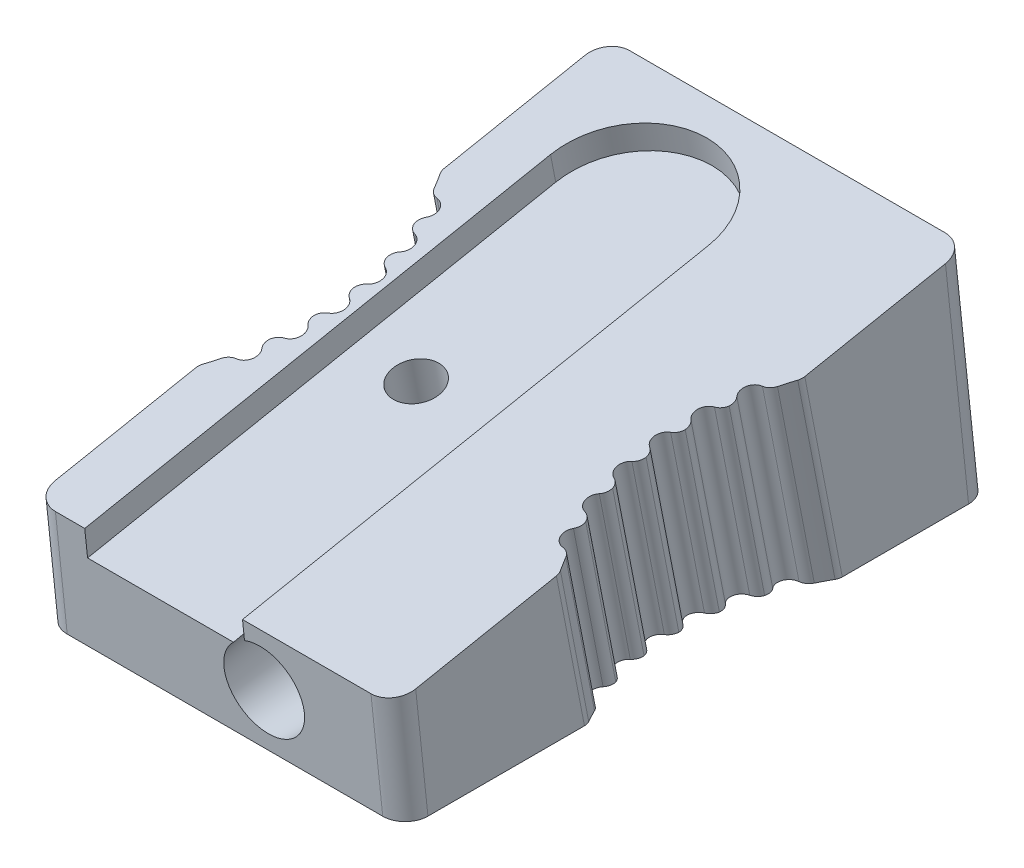
from build123d import *

# Parameters (mm, degrees)
BOSS_EXTRUDE1_DEPTH          = 16
CUT_EXTRUDE1_REACH           = 32.943
CUT_EXTRUDE4_DEPTH           = 1.2
SKETCH6_W                    = 7.000000000000001
SKETCH6_H                    = 1.1999999999999869
CUT_EXTRUDE5_DEPTH           = 1.2
M2_5X0_45_TAPPED_HOLE2_D     = 2.05
M2_5X0_45_TAPPED_HOLE2_DEPTH = 4
M2_5X0_45_TAPPED_HOLE2_TIP   = 0.6158821345032492
SKETCH11_R                   = 0.5000000000000004
SKETCH11_R_2                 = 0.5000000000000009
SKETCH11_R_3                 = 0.49999999999999917
CUT_EXTRUDE6_DEPTH           = 31.9427848040178
FILLET1_R                    = 1
FILLET3_R                    = 0.5


with BuildPart() as part:
    # Sketch1 → Boss-Extrude1 (new body)
    with BuildSketch(Plane(origin=(0, 0, 0), x_dir=(0, 0, -1), z_dir=(1, 0, 0))):
        Polygon((0, 0), (-26, 0), (-26.522642316338285, 4.972609476841361), (-1.0452846326765777, 9.945218953682728), align=None)
    extrude(amount=BOSS_EXTRUDE1_DEPTH)

    # Cut-Extrude1: up to this plane
    cut_extrude1_end = Plane(origin=(16, 0, 0), z_dir=(0, 1, 0))
    # Sketch2 → Cut-Extrude1 (cut, up to the surface)
    with BuildSketch(Plane(origin=(0, 9.776794987365424, 1.9082113620630834), x_dir=(1, 0, 0), z_dir=(0, 0.9814803246385702, 0.19156297227639538)), mode=Mode.PRIVATE) as cut_extrude1_sk1:
        with BuildLine():
            Line((0, -6.62079059791211), (0, -17.578883739558876))
            ThreePointArc((0, -17.578883739558876), (1.5000000000000018, -12.099837168735492), (0, -6.62079059791211))
        make_face()
    cut_extrude1_tool1 = split(extrude(cut_extrude1_sk1.sketch, amount=-CUT_EXTRUDE1_REACH, mode=Mode.PRIVATE), bisect_by=cut_extrude1_end, keep=Keep.BOTH, mode=Mode.PRIVATE)
    add(cut_extrude1_tool1.solids().sort_by_distance((0.603737, 7.458914, 13.783963))[0], mode=Mode.SUBTRACT)
    # Sketch2 → Cut-Extrude1 (cut, up to the surface)
    with BuildSketch(Plane(origin=(0, 9.776794987365424, 1.9082113620630834), x_dir=(1, 0, 0), z_dir=(0, 0.9814803246385702, 0.19156297227639538)), mode=Mode.PRIVATE) as cut_extrude1_sk2:
        with BuildLine():
            Line((16, -6.62079059791211), (16, -17.578883739558876))
            ThreePointArc((16, -17.578883739558876), (14.499999999999998, -12.09983716873549), (16, -6.62079059791211))
        make_face()
    cut_extrude1_tool2 = split(extrude(cut_extrude1_sk2.sketch, amount=-CUT_EXTRUDE1_REACH, mode=Mode.PRIVATE), bisect_by=cut_extrude1_end, keep=Keep.BOTH, mode=Mode.PRIVATE)
    add(cut_extrude1_tool2.solids().sort_by_distance((15.396263, 7.458914, 13.783963))[0], mode=Mode.SUBTRACT)

    # Sketch3 → Cut-Revolve2 (revolve, cut)
    with BuildSketch(Plane(origin=(10, 0, 0), x_dir=(0, 0, -1), z_dir=(1, 0, 0)), mode=Mode.PRIVATE) as cut_revolve2_sk:
        Polygon((-27.256723261264806, 2.390150892266835), (-26.261321158169142, 2.486304738420681), (-0.5226423163382883, 4.972609476841364), (0.4727597867573756, 5.068763322995212), (0.05464593368674497, 9.046850904468306), (-27.43442164881982, 4.080838114392899), align=None)
    revolve(cut_revolve2_sk.sketch.rotate(Axis((10, 2.390150892266835, 27.256723261264806), (0, 0.09615043724968246, -0.9953668134997745)), 180), axis=Axis((10, 2.390150892266835, 27.256723261264806), (0, 0.09615043724968246, -0.9953668134997745)), mode=Mode.SUBTRACT)

    # Sketch4 → Cut-Extrude4 (cut)
    with BuildSketch(Plane(origin=(0, 9.776794987365424, 1.9082113620630834), x_dir=(1, 0, 0), z_dir=(0, 0.9814803246385702, 0.19156297227639538))):
        with BuildLine():
            Line((2.3, -25.078883739558876), (2.3, -4.02079059791211))
            ThreePointArc((2.3, -4.02079059791211), (5.8, -0.5207905979121099), (9.299999999999999, -4.02079059791211))
            Line((9.299999999999999, -4.02079059791211), (9.299999999999999, -25.078883739558876))
            Line((9.299999999999999, -25.078883739558876), (2.3, -25.078883739558876))
        make_face()
    extrude(amount=-CUT_EXTRUDE4_DEPTH, mode=Mode.SUBTRACT)

    # Sketch6 → Cut-Extrude5 (cut)
    with BuildSketch(Plane(origin=(0, -4.8041855105240625, 24.61443095427521), x_dir=(-1, 0, 0), z_dir=(0, 0.1915629722763954, -0.9814803246385702))):
        with Locations((-5.799999999999999, 9.36127455837256)):
            Rectangle(SKETCH6_W, SKETCH6_H)
    extrude(amount=-CUT_EXTRUDE5_DEPTH, mode=Mode.SUBTRACT)

    # M2.5x0.45 Tapped Hole2
    with Locations(Plane(origin=(5.1, 6.073299307, 14.618956627), x_dir=(0, -0.191562972276, 0.981480324639), z_dir=(0, 0.981480324639, 0.191562972276))):
        with Locations((0, 0)):
            Hole(M2_5X0_45_TAPPED_HOLE2_D / 2, depth=M2_5X0_45_TAPPED_HOLE2_DEPTH)
            with Locations((0, 0, -(M2_5X0_45_TAPPED_HOLE2_DEPTH + M2_5X0_45_TAPPED_HOLE2_TIP / 2))):  # 118° drill point
                Cone(0, M2_5X0_45_TAPPED_HOLE2_D / 2, M2_5X0_45_TAPPED_HOLE2_TIP, mode=Mode.SUBTRACT)

    # Sketch11 → Cut-Extrude6 (cut, through all)
    with BuildSketch(Plane(origin=(0, 9.776794987365424, 1.9082113620630834), x_dir=(1, 0, 0), z_dir=(0, 0.9814803246385702, 0.19156297227639538))):
        with Locations((0.7290719760898604, -8.100977766374406)):
            Circle(SKETCH11_R)
        with Locations((1.223184312982648, -9.67525633083825)):
            Circle(SKETCH11_R_2)
        with Locations((1.47071076557147, -11.306584211820118)):
            Circle(SKETCH11_R)
        with Locations((1.4658271457246748, -12.956576984609502)):
            Circle(SKETCH11_R)
        with Locations((1.208648362860844, -14.586411047833327)):
            Circle(SKETCH11_R)
        with Locations((0.7052257201809217, -16.15773712565332)):
            Circle(SKETCH11_R)
        with Locations((15.294774279819078, -16.15773712565332)):
            Circle(SKETCH11_R_3)
        with Locations((14.791351637139156, -14.586411047833327)):
            Circle(SKETCH11_R_2)
        with Locations((14.534172854275326, -12.956576984609502)):
            Circle(SKETCH11_R_2)
        with Locations((14.52928923442853, -11.306584211820118)):
            Circle(SKETCH11_R_3)
        with Locations((14.77681568701735, -9.67525633083825)):
            Circle(SKETCH11_R_3)
        with Locations((15.270928023910141, -8.100977766374406)):
            Circle(SKETCH11_R_2)
    extrude(amount=-CUT_EXTRUDE6_DEPTH, mode=Mode.SUBTRACT)

    # Fillet1
    fillet1_edges = [part.edges().sort_by_distance(p)[0] for p in [
        (16, 2.4863047384206807, 26.261321158169142),
        (16, 4.972609476841364, 0.5226423163382888),
        (0, 2.4863047384206807, 26.261321158169142),
        (0, 4.972609476841364, 0.5226423163382888),
    ]]
    fillet(fillet1_edges, radius=FILLET1_R)

    # Fillet3
    # the kernel refuses this fillet: 0.5 mm, written as the material it takes off along each edge
    with BuildSketch(Plane(origin=(-8.9e-16, 8.84027782449705, 8.471143317909705), x_dir=(6.568558896759944e-15, 0.19156297227639535, -0.9814803246385702), z_dir=(0, -0.9814803246385702, -0.19156297227639538))) as fillet3_piece_1:
        with BuildLine():
            CenterArc((0.13521663330723216, 0.5000000000000001), FILLET3_R, 240.08261327743668, 29.917386722562924)
            ThreePointArc((-0.11415875740879698, 0.06662727992497329), (-0.056977036870341, 0.0334889918096563), (0, 0))
            Line((0, 0), (0.13521663330722888, 0))
        make_face()
    extrude(amount=9.345127718950396, mode=Mode.SUBTRACT)
    with BuildSketch(Plane(origin=(0, 6.741112931801604, 19.22629613199286), x_dir=(0.5040667225652466, 0.16544617977427759, -0.8476699244401845), z_dir=(0, -0.9814803246385702, -0.19156297227639538))) as fillet3_piece_2:
        with BuildLine():
            CenterArc((0.13525152627151035, 0.4999905624749505), FILLET3_R, 239.73058109352934, 29.917386722571507)
            Line((-0.11678183501117555, 0.06815820518736707), (0, 0))
            ThreePointArc((0, 0), (0.06608974262947756, 0.00020303231598987), (0.13217948525895262, 0))
        make_face()
    extrude(amount=7.206353420577709, mode=Mode.SUBTRACT)
    with BuildSketch(Plane(origin=(0.9041123722790791, -0.8507763634373475, 8.564980938480485), x_dir=(0.8189747474071976, 0.1099244959567053, -0.5632024221343348), z_dir=(0, 0.9814803246385702, 0.19156297227639538))) as fillet3_piece_3:
        with BuildLine():
            CenterArc((0.3762150218917622, -0.48401816509794676), FILLET3_R, 104.52544984263686, 57.77038124776779)
            ThreePointArc((-0.10010465656917535, -0.3319669766419895), (-0.04871465560991424, -0.1663868635755278), (0, 0))
            ThreePointArc((0, 0), (0.1254050072972659, -0.01598183490205357), (0.250810014594537, -1e-17))
        make_face()
    extrude(amount=10.022391383047378, mode=Mode.SUBTRACT)
    with BuildSketch(Plane(origin=(0.5324558554564609, -0.8507763634373315, 7.6193895486969305), x_dir=(-0.4291086570829379, 0.17302980589976627, -0.8865249272788481), z_dir=(0, 0.9814803246385702, 0.19156297227639538))) as fillet3_piece_4:
        with BuildLine():
            CenterArc((0.35479045509600643, -0.49993505559679685), FILLET3_R, 90.92348148822464, 57.77038124776763)
            ThreePointArc((-0.07241113325413223, -0.24012973827030512), (-0.02090428833356213, -0.1246789702850145), (0, 0))
            ThreePointArc((0, 0), (0.1733659538719006, -0.00139716848681071), (0.3467319077437987, 3e-17))
        make_face()
    extrude(amount=10.203531680233258, mode=Mode.SUBTRACT)
    with BuildSketch(Plane(origin=(1.3245336837372133, -0.8507763634374137, 10.190626753655996), x_dir=(0.8971021301305255, 0.08463697149506566, -0.43364080893225093), z_dir=(0, 0.9814803246385702, 0.19156297227639538))) as fillet3_piece_5:
        with BuildLine():
            CenterArc((0.37621502189180767, -0.48401816509793244), FILLET3_R, 104.52544984264316, 57.770381247768)
            ThreePointArc((-0.10010465656914697, -0.331966976642029), (-0.0487146556099016, -0.16638686357554658), (0, 0))
            ThreePointArc((0, 0), (0.12540500729726603, -0.01598183490206699), (0.2508100145945294, 1e-17))
        make_face()
    extrude(amount=9.71097783882381, mode=Mode.SUBTRACT)
    with BuildSketch(Plane(origin=(1.0991916103360686, -0.8507763634374115, 9.198245722442355), x_dir=(-0.28591530273302007, 0.18356615547195718, -0.9405083233168811), z_dir=(0, 0.9814803246385702, 0.19156297227639538))) as fillet3_piece_6:
        with BuildLine():
            CenterArc((0.3547904550960354, -0.49993505559679685), FILLET3_R, 90.92348148822451, 57.770381247767844)
            ThreePointArc((-0.07241113325410303, -0.24012973827030598), (-0.02090428833353382, -0.12467897028501924), (0, 0))
            ThreePointArc((0, 0), (0.17336595387191708, -0.00139716848681245), (0.34673190774382884, 1e-17))
        make_face()
    extrude(amount=9.901081298793802, mode=Mode.SUBTRACT)
    with BuildSketch(Plane(origin=(1.4959844049493585, -0.8507763634373418, 11.862660417370378), x_dir=(0.9541210958561219, 0.05735797646647942, -0.2938758189745864), z_dir=(0, 0.9814803246385702, 0.19156297227639538))) as fillet3_piece_7:
        with BuildLine():
            CenterArc((0.3762150218917593, -0.4840181650979468), FILLET3_R, 104.52544984263653, 57.7703812477678)
            ThreePointArc((-0.10010465656917733, -0.33196697664198677), (-0.04871465560991481, -0.1663868635755268), (0, 0))
            ThreePointArc((0, 0), (0.12540500729726625, -0.01598183490205324), (0.25081001459453706, 2e-17))
        make_face()
    extrude(amount=9.390678100456343, mode=Mode.SUBTRACT)
    with BuildSketch(Plane(origin=(1.4222589744547673, -0.8507763634373324, 10.846840032195322), x_dir=(-0.13599448755852672, 0.18978327446134854, -0.972361973798041), z_dir=(0, 0.9814803246385702, 0.19156297227639538))) as fillet3_piece_8:
        with BuildLine():
            CenterArc((0.35479045509600565, -0.49993505559679685), FILLET3_R, 90.92348148822452, 57.7703812477678)
            ThreePointArc((-0.07241113325413356, -0.2401297382703053), (-0.02090428833355943, -0.12467897028501575), (0, 0))
            ThreePointArc((0, 0), (0.1733659538718988, -0.00139716848681048), (0.346731907743799, 0))
        make_face()
    extrude(amount=9.58527167273942, mode=Mode.SUBTRACT)
    with BuildSketch(Plane(origin=(1.414430376151146, -0.850776363437344, 13.541739715819348), x_dir=(0.9886900134979009, 0.028729373578601385, -0.14719606076013553), z_dir=(0, 0.9814803246385702, 0.19156297227639538))) as fillet3_piece_9:
        with BuildLine():
            CenterArc((0.376215021891753, -0.4840181650979482), FILLET3_R, 104.52544984263595, 57.7703812477681)
            ThreePointArc((-0.10010465656918284, -0.33196697664198593), (-0.04871465560991895, -0.16638686357552782), (0, 0))
            ThreePointArc((0, 0), (0.125405007297266, -0.01598183490205113), (0.2508100145945357, 0))
        make_face()
    extrude(amount=9.069028679357697, mode=Mode.SUBTRACT)
    with BuildSketch(Plane(origin=(1.4940563153884647, -0.8507763634373338, 12.526381781800541), x_dir=(0.017126217858494646, 0.19153487680335024, -0.9813363763918002), z_dir=(0, 0.9814803246385702, 0.19156297227639538))) as fillet3_piece_10:
        with BuildLine():
            CenterArc((0.3547904550960016, -0.499935055596797), FILLET3_R, 90.92348148822401, 57.770381247767745)
            ThreePointArc((-0.07241113325413433, -0.24012973827030146), (-0.0209042883335607, -0.12467897028501354), (0, 0))
            ThreePointArc((0, 0), (0.17336595387189982, -0.00139716848680998), (0.34673190774379936, 0))
        make_face()
    extrude(amount=9.263533663122749, mode=Mode.SUBTRACT)
    with BuildSketch(Plane(origin=(1.081790527629206, -0.8507763634373258, 15.188356654524544), x_dir=(0.9999954916879522, -0.0005752187838453385, 0.0029471557681415915), z_dir=(0, 0.9814803246385702, 0.19156297227639538))) as fillet3_piece_11:
        with BuildLine():
            CenterArc((0.3762150218917628, -0.4840181650979456), FILLET3_R, 104.52544984263676, 57.77038124776712)
            ThreePointArc((-0.10010465656917295, -0.33196697664198166), (-0.04871465560991308, -0.16638686357552615), (0, 0))
            ThreePointArc((0, 0), (0.12540500729726758, -0.01598183490205386), (0.25081001459453883, 0))
        make_face()
    extrude(amount=8.753597844378637, mode=Mode.SUBTRACT)
    with BuildSketch(Plane(origin=(1.3128942734078017, -0.8507763634373329, 14.197352095508087), x_dir=(0.16984395093157206, 0.18877974806829237, -0.967220367367864), z_dir=(0, 0.9814803246385702, 0.19156297227639538))) as fillet3_piece_12:
        with BuildLine():
            CenterArc((0.3547904550960046, -0.49993505559679674), FILLET3_R, 90.9234814882244, 57.77038124776759)
            ThreePointArc((-0.07241113325413241, -0.24012973827030312), (-0.02090428833355955, -0.12467897028501342), (0, 0))
            ThreePointArc((0, 0), (0.17336595387190104, -0.00139716848681042), (0.34673190774379903, 1e-17))
        make_face()
    extrude(amount=8.943437623243309, mode=Mode.SUBTRACT)
    with BuildSketch(Plane(origin=(0.5058917281388445, -0.8507763634373608, 16.76376706399826), x_dir=(0.9877715175165039, -0.029866276502300365, 0.15302102702253312), z_dir=(0, 0.9814803246385702, 0.19156297227639538))) as fillet3_piece_13:
        with BuildLine():
            CenterArc((0.3762150218917617, -0.4840181650979452), FILLET3_R, 104.52544984263687, 57.770381247768626)
            ThreePointArc((-0.10010465656917751, -0.3319669766419951), (-0.0487146556099147, -0.16638686357553534), (0, 0))
            ThreePointArc((0, 0), (0.12540500729726767, -0.01598183490205408), (0.2508100145945368, 0))
        make_face()
    extrude(amount=8.45180754378475, mode=Mode.SUBTRACT)
    with BuildSketch(Plane(origin=(0.8830355113666977, -0.8507763634373338, 15.820433779669933), x_dir=(0.3185653308355022, 0.1815827152187566, -0.9303460901855024), z_dir=(0, 0.9814803246385702, 0.19156297227639538))) as fillet3_piece_14:
        with BuildLine():
            CenterArc((0.35479045509600166, -0.4999350555967969), FILLET3_R, 90.92348148822403, 57.77038124776756)
            ThreePointArc((-0.07241113325413301, -0.2401297382703006), (-0.02090428833355908, -0.12467897028501372), (0, 0))
            ThreePointArc((0, 0), (0.17336595387190032, -0.00139716848680764), (0.3467319077437993, 0))
        make_face()
    extrude(amount=8.632515271577889, mode=Mode.SUBTRACT)
    with BuildSketch(Plane(origin=(16, 6.741112931801586, 19.226296131992857), x_dir=(-0.5040667225652338, 0.165446179774279, -0.8476699244401917), z_dir=(0, -0.9814803246385702, -0.19156297227639538))) as fillet3_piece_15:
        with BuildLine():
            CenterArc((0.1352515262715016, -0.49999056247495016), FILLET3_R, 90.35203218389827, 29.917386722570683)
            Line((-0.11678183501117242, -0.06815820518735785), (0, 0))
            ThreePointArc((0, 0), (0.06608974262948056, -0.00020303231598909), (0.13217948525895146, 2e-17))
        make_face()
    extrude(amount=7.206353420577674, mode=Mode.SUBTRACT)
    with BuildSketch(Plane(origin=(16, 8.840277824497045, 8.471143317909705), x_dir=(0, 0.19156297227639535, -0.98148032463857), z_dir=(0, -0.9814803246385702, -0.19156297227639538))) as fillet3_piece_16:
        with BuildLine():
            CenterArc((0.13521663330722677, -0.5), FILLET3_R, 90, 29.917386722563208)
            ThreePointArc((-0.11415875740880158, -0.06662727992497253), (-0.05697703687034154, -0.03348899180965503), (0, 0))
            Line((0, 0), (0.13521663330722677, 0))
        make_face()
    extrude(amount=9.345127718950387, mode=Mode.SUBTRACT)
    with BuildSketch(Plane(origin=(15.1169644886333, -0.8507763634373315, 15.820433779669933), x_dir=(-0.3185653308354956, 0.18158271521875696, -0.9303460901855045), z_dir=(0, 0.9814803246385702, 0.19156297227639538))) as fillet3_piece_17:
        with BuildLine():
            CenterArc((0.3547904550959971, 0.49993505559679646), FILLET3_R, 211.3061372640089, 57.77038124776749)
            ThreePointArc((-0.07241113325413587, 0.24012973827029624), (-0.02090428833356441, 0.12467897028501176), (0, 0))
            ThreePointArc((0, 0), (0.17336595387190015, 0.00139716848680865), (0.3467319077437984, 0))
        make_face()
    extrude(amount=8.632515271577885, mode=Mode.SUBTRACT)
    with BuildSketch(Plane(origin=(15.494108271861156, -0.8507763634373524, 16.76376706399826), x_dir=(-0.9877715175165045, -0.029866276502300025, 0.1530210270225314), z_dir=(0, 0.9814803246385702, 0.19156297227639538))) as fillet3_piece_18:
        with BuildLine():
            CenterArc((0.37621502189176137, 0.4840181650979457), FILLET3_R, 197.704168909595, 57.77038124776823)
            ThreePointArc((-0.10010465656917691, 0.33196697664199126), (-0.0487146556099134, 0.16638686357552773), (0, 0))
            ThreePointArc((0, 0), (0.12540500729726797, 0.01598183490205409), (0.25081001459453756, 0))
        make_face()
    extrude(amount=8.45180754378473, mode=Mode.SUBTRACT)
    with BuildSketch(Plane(origin=(14.687105726592199, -0.8507763634373378, 14.197352095508087), x_dir=(-0.16984395093157742, 0.18877974806829217, -0.9672203673678631), z_dir=(0, 0.9814803246385702, 0.19156297227639538))) as fillet3_piece_19:
        with BuildLine():
            CenterArc((0.35479045509600937, 0.4999350555967965), FILLET3_R, 211.30613726400765, 57.77038124776766)
            ThreePointArc((-0.07241113325412894, 0.2401297382703059), (-0.02090428833355873, 0.12467897028501487), (0, 0))
            ThreePointArc((0, 0), (0.17336595387190126, 0.00139716848681171), (0.34673190774380114, 1e-17))
        make_face()
    extrude(amount=8.943437623243318, mode=Mode.SUBTRACT)
    with BuildSketch(Plane(origin=(14.918209472370792, -0.8507763634373466, 15.18835665452454), x_dir=(-0.999995491687952, -0.0005752187838454116, 0.0029471557681419657), z_dir=(0, 0.9814803246385702, 0.19156297227639538))) as fillet3_piece_20:
        with BuildLine():
            CenterArc((0.3762150218917571, 0.48401816509794876), FILLET3_R, 197.7041689095957, 57.77038124776789)
            ThreePointArc((-0.100104656569179, 0.3319669766419887), (-0.04871465560991478, 0.16638686357552956), (0, 0))
            ThreePointArc((0, 0), (0.125405007297266, 0.01598183490205373), (0.2508100145945352, 0))
        make_face()
    extrude(amount=8.753597844378675, mode=Mode.SUBTRACT)
    with BuildSketch(Plane(origin=(14.505943684611536, -0.8507763634373342, 12.526381781800541), x_dir=(-0.017126217858495926, 0.19153487680335024, -0.9813363763918002), z_dir=(0, 0.9814803246385702, 0.19156297227639538))) as fillet3_piece_21:
        with BuildLine():
            CenterArc((0.35479045509600227, 0.49993505559679735), FILLET3_R, 211.30613726400827, 57.77038124776766)
            ThreePointArc((-0.07241113325413402, 0.24012973827030154), (-0.02090428833356055, 0.12467897028501357), (0, 0))
            ThreePointArc((0, 0), (0.17336595387190337, 0.00139716848680837), (0.3467319077437994, 0))
        make_face()
    extrude(amount=9.263533663122749, mode=Mode.SUBTRACT)
    with BuildSketch(Plane(origin=(14.585569623848851, -0.8507763634373453, 13.541739715819348), x_dir=(-0.9886900134979008, 0.02872937357860178, -0.14719606076013753), z_dir=(0, 0.9814803246385702, 0.19156297227639538))) as fillet3_piece_22:
        with BuildLine():
            CenterArc((0.3762150218917472, 0.4840181650979484), FILLET3_R, 197.7041689095961, 57.77038124776817)
            ThreePointArc((-0.1001046565691877, 0.33196697664198516), (-0.04871465560992195, 0.16638686357552743), (0, 0))
            ThreePointArc((0, 0), (0.12540500729726534, 0.01598183490205137), (0.2508100145945318, 0))
        make_face()
    extrude(amount=9.0690286793577, mode=Mode.SUBTRACT)
    with BuildSketch(Plane(origin=(14.577741025545231, -0.8507763634373329, 10.846840032195322), x_dir=(0.13599448755853047, 0.18978327446134843, -0.9723619737980406), z_dir=(0, 0.9814803246385702, 0.19156297227639538))) as fillet3_piece_23:
        with BuildLine():
            CenterArc((0.35479045509600415, 0.4999350555967963), FILLET3_R, 211.30613726400802, 57.77038124776766)
            ThreePointArc((-0.07241113325413258, 0.24012973827030282), (-0.02090428833356162, 0.12467897028501343), (0, 0))
            ThreePointArc((0, 0), (0.173365953871899, 0.00139716848680981), (0.34673190774379925, 0))
        make_face()
    extrude(amount=9.58527167273942, mode=Mode.SUBTRACT)
    with BuildSketch(Plane(origin=(14.504015595050639, -0.8507763634373409, 11.86266041737038), x_dir=(-0.9541210958561195, 0.05735797646648098, -0.2938758189745944), z_dir=(0, 0.9814803246385702, 0.19156297227639538))) as fillet3_piece_24:
        with BuildLine():
            CenterArc((0.3762150218917545, 0.48401816509794815), FILLET3_R, 197.70416890959598, 57.77038124776794)
            ThreePointArc((-0.10010465656918101, 0.3319669766419857), (-0.04871465560991879, 0.16638686357552568), (0, 0))
            ThreePointArc((0, 0), (0.12540500729726495, 0.01598183490205212), (0.2508100145945359, 0))
        make_face()
    extrude(amount=9.390678100456341, mode=Mode.SUBTRACT)
    with BuildSketch(Plane(origin=(14.90080838966393, -0.8507763634374079, 9.198245722442357), x_dir=(0.2859153027330282, 0.18356615547195673, -0.9405083233168786), z_dir=(0, 0.9814803246385702, 0.19156297227639538))) as fillet3_piece_25:
        with BuildLine():
            CenterArc((0.35479045509602963, 0.4999350555967975), FILLET3_R, 211.3061372640082, 57.77038124776777)
            ThreePointArc((-0.0724111332541061, 0.24012973827030268), (-0.0209042883335366, 0.12467897028501876), (0, 0))
            ThreePointArc((0, 0), (0.17336595387191572, 0.00139716848681119), (0.3467319077438275, 0))
        make_face()
    extrude(amount=9.901081298793795, mode=Mode.SUBTRACT)
    with BuildSketch(Plane(origin=(14.675466316262785, -0.8507763634374088, 10.190626753656), x_dir=(-0.8971021301305181, 0.08463697149506859, -0.433640808932266), z_dir=(0, 0.9814803246385702, 0.19156297227639538))) as fillet3_piece_26:
        with BuildLine():
            CenterArc((0.376215021891799, 0.4840181650979346), FILLET3_R, 197.7041689095896, 57.77038124776823)
            ThreePointArc((-0.10010465656915297, 0.33196697664202507), (-0.0487146556099036, 0.16638686357554403), (0, 0))
            ThreePointArc((0, 0), (0.1254050072972662, 0.01598183490206527), (0.25081001459452906, 0))
        make_face()
    extrude(amount=9.7109778388238, mode=Mode.SUBTRACT)
    with BuildSketch(Plane(origin=(15.467544144543528, -0.8507763634374061, 7.619389548696939), x_dir=(0.42910865708294166, 0.17302980589976596, -0.8865249272788464), z_dir=(0, 0.9814803246385702, 0.19156297227639538))) as fillet3_piece_27:
        with BuildLine():
            CenterArc((0.35479045509603263, 0.49993505559679774), FILLET3_R, 211.30613726400813, 57.770381247767546)
            ThreePointArc((-0.07241113325410442, 0.24012973827030298), (-0.0209042883335355, 0.12467897028501611), (0, 0))
            ThreePointArc((0, 0), (0.17336595387191303, 0.00139716848681047), (0.3467319077438274, 1e-17))
        make_face()
    extrude(amount=10.2035316802334, mode=Mode.SUBTRACT)
    with BuildSketch(Plane(origin=(15.095887627720929, -0.850776363437399, 8.56498093848045), x_dir=(-0.8189747474072521, 0.10992449595669035, -0.5632024221342583), z_dir=(0, 0.9814803246385702, 0.19156297227639538))) as fillet3_piece_28:
        with BuildLine():
            CenterArc((0.3762150218918041, 0.48401816509793455), FILLET3_R, 197.70416890958984, 57.77038124776749)
            ThreePointArc((-0.10010465656914745, 0.3319669766420232), (-0.04871465560990263, 0.16638686357554305), (0, 0))
            ThreePointArc((0, 0), (0.12540500729726536, 0.01598183490206698), (0.25081001459452973, 0))
        make_face()
    extrude(amount=10.022391383047495, mode=Mode.SUBTRACT)


solid = part.part
